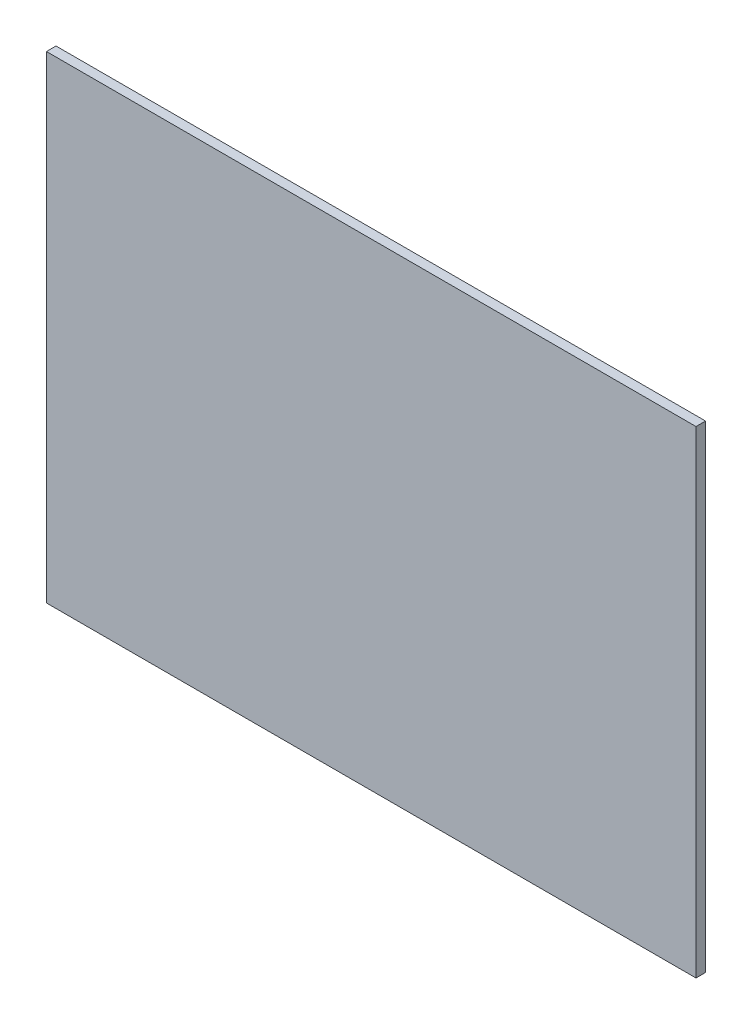
from build123d import *

# Parameters (mm, degrees)
SKETCH1_W           = 340
SKETCH1_H           = 250
BOSS_EXTRUDE1_DEPTH = 5


with BuildPart() as part:
    # Sketch1 → Boss-Extrude1 (new body)
    with BuildSketch(Plane.XY):
        Rectangle(SKETCH1_W, SKETCH1_H)
    extrude(amount=BOSS_EXTRUDE1_DEPTH)


solid = part.part
